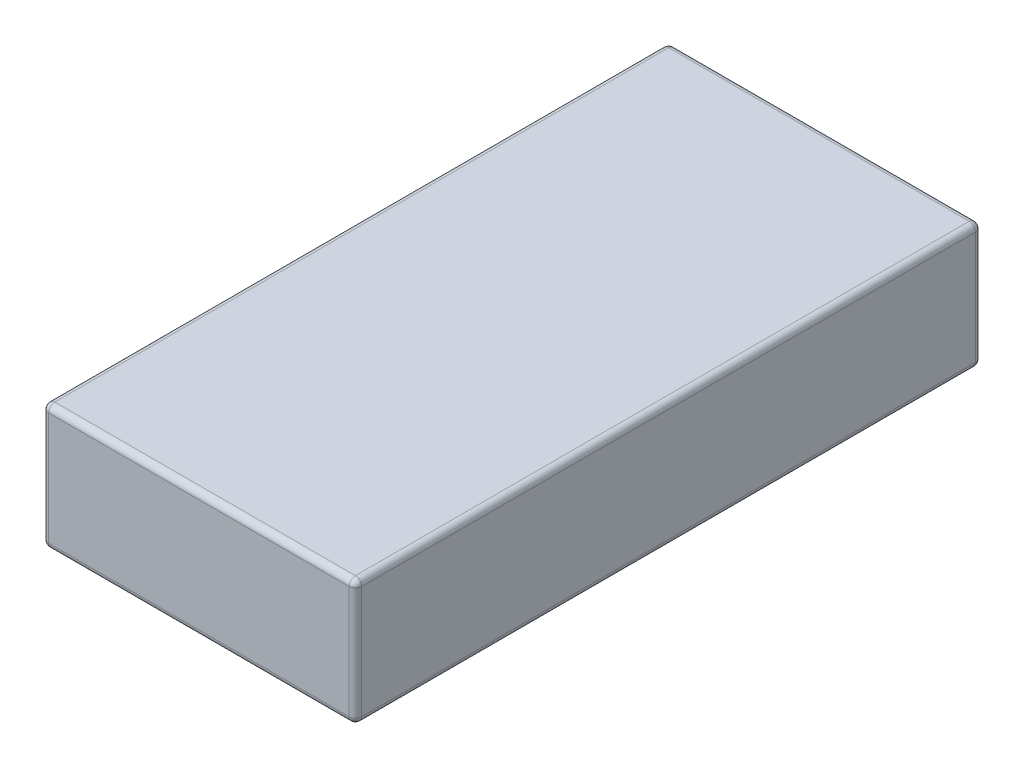
from build123d import *

# Parameters (mm, degrees)
SKETCH1_W           = 5
SKETCH1_H           = 10
BOSS_EXTRUDE1_DEPTH = 2
FILLET1_R           = 0.1


with BuildPart() as part:
    # Sketch1 → Boss-Extrude1 (new body)
    with BuildSketch(Plane(origin=(0, 0, 0), x_dir=(1, 0, 0), z_dir=(0, 1, 0))):
        Rectangle(SKETCH1_W, SKETCH1_H)
    extrude(amount=BOSS_EXTRUDE1_DEPTH)

    # Fillet1
    fillet1_edges = [part.edges().sort_by_distance(p)[0] for p in [
        (2.5, 0, 0),
        (2.5, 1, -5),
        (0, 0, -5),
        (-2.5, 1, -5),
        (-2.5, 0, 0),
        (-2.5, 1, 5),
        (2.5, 1, 5),
        (0, 0, 5),
        (0, 2, 5),
        (-2.5, 2, 0),
        (0, 2, -5),
        (2.5, 2, 0),
    ]]
    fillet(fillet1_edges, radius=FILLET1_R)


solid = part.part
